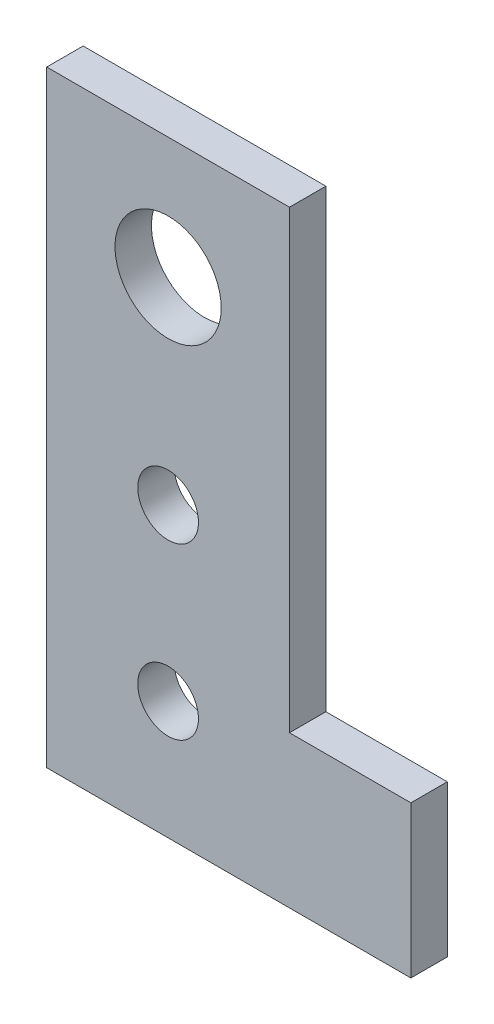
from build123d import *

# Parameters (mm, degrees)
SKETCH_1_R             = 1.75
SKETCH_1_R_2           = 1
SM_BASE_FLANGE_1_DEPTH = 1.2


# Sheet-metal steps are written as plain solids
with BuildPart() as part:
    # Sketch 1 → Базовая кромка1 (new body)
    with BuildSketch(Plane.XY):
        Polygon((0, 0), (12, 0), (12, 5), (8, 5), (8, 20), (0, 20), align=None)
        with Locations((4, 16)):
            Circle(SKETCH_1_R, mode=Mode.SUBTRACT)
        with Locations((4, 9.5)):
            Circle(SKETCH_1_R_2, mode=Mode.SUBTRACT)
        with Locations((4, 3.9)):
            Circle(SKETCH_1_R_2, mode=Mode.SUBTRACT)
    extrude(amount=-SM_BASE_FLANGE_1_DEPTH)


solid = part.part
